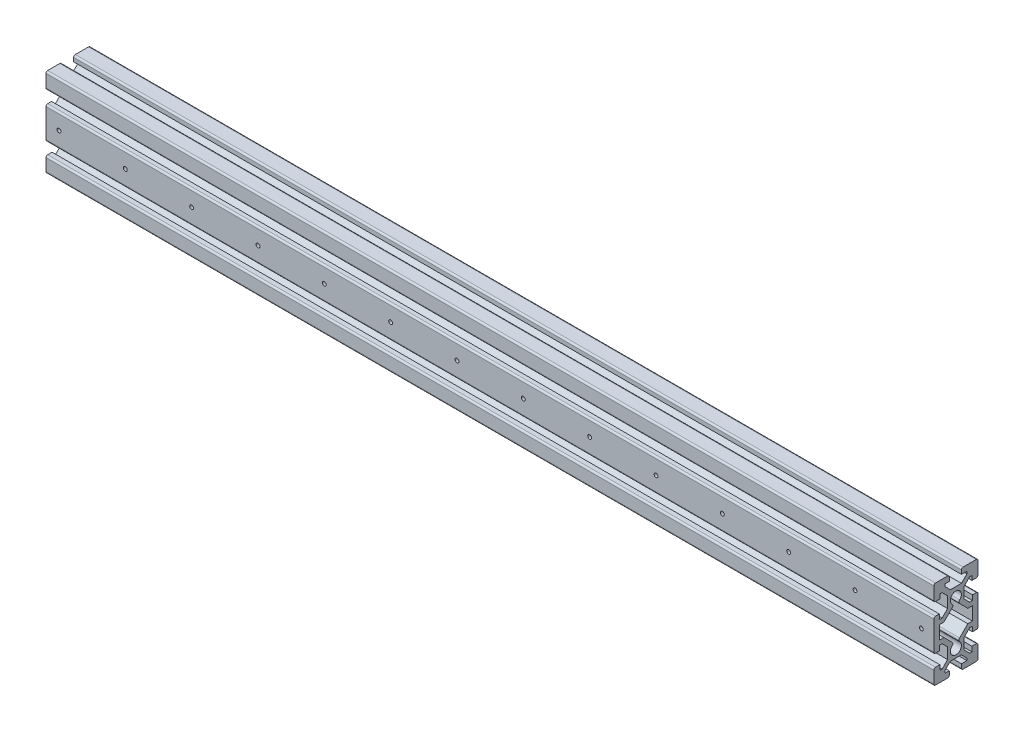
from build123d import *

# Parameters (mm, degrees)
ESTRUSIONE_ESTRUSIONE1_DEPTH = 803
SCHIZZO2_R                   = 1.75
TAGLIO_ESTRUSIONE1_DEPTH     = 10


with BuildPart() as part:
    # Schizzo1 → Estrusione-Estrusione1 (new body)
    with BuildSketch(Plane(origin=(0, 0, 0), x_dir=(0, 0, -1), z_dir=(1, 0, 0))):
        with BuildLine():
            Line((6.5, -39.5), (18.5, -39.5))
            ThreePointArc((18.5, -39.5), (19.560660172, -39.060660172), (20, -38))
            Line((20, -38), (20, -27))
            ThreePointArc((20, -27), (19.560660172, -25.939339828), (18.5, -25.5))
            Line((18.5, -25.5), (14.5, -25.5))
            Line((14.5, -25.5), (14.5, -29.949747468))
            Line((14.5, -29.949747468), (12.449747468, -29.949747468))
            Line((12.449747468, -29.949747468), (7.5, -25))
            Line((7.5, -25), (7.5, -15))
            Line((7.5, -15), (12.449747468, -10.050252532))
            Line((12.449747468, -10.050252532), (15, -10.050252532))
            Line((15, -10.050252532), (15, -14.5))
            Line((15, -14.5), (18.5, -14.5))
            ThreePointArc((18.5, -14.5), (19.560660172, -14.060660172), (20, -13))
            Line((20, -13), (20, 13))
            ThreePointArc((20, 13), (19.560660172, 14.060660172), (18.5, 14.5))
            Line((18.5, 14.5), (15, 14.5))
            Line((15, 14.5), (15, 10.050252532))
            Line((15, 10.050252532), (12.449747468, 10.050252532))
            Line((12.449747468, 10.050252532), (7.5, 15))
            Line((7.5, 15), (7.5, 25))
            Line((7.5, 25), (12.449747468, 29.949747468))
            Line((12.449747468, 29.949747468), (14.5, 29.949747468))
            Line((14.5, 29.949747468), (14.5, 26))
            Line((14.5, 26), (18.5, 26))
            ThreePointArc((18.5, 26), (19.560660172, 26.439339828), (20, 27.5))
            Line((20, 27.5), (20, 39))
            ThreePointArc((20, 39), (19.560660172, 40.060660172), (18.5, 40.5))
            Line((18.5, 40.5), (6.5, 40.5))
            ThreePointArc((6.5, 40.5), (5.439339828, 40.060660172), (5, 39))
            Line((5, 39), (5, 35.5))
            Line((5, 35.5), (9.949747468, 35.5))
            Line((9.949747468, 35.5), (9.949747468, 33.449747468))
            Line((9.949747468, 33.449747468), (5, 28.5))
            Line((5, 28.5), (-5, 28.5))
            Line((-5, 28.5), (-9.949747468, 33.449747468))
            Line((-9.949747468, 33.449747468), (-9.949747468, 35.5))
            Line((-9.949747468, 35.5), (-6, 35.5))
            Line((-6, 35.5), (-6, 39))
            ThreePointArc((-6, 39), (-6.439339828, 40.060660172), (-7.5, 40.5))
            Line((-7.5, 40.5), (-18.5, 40.5))
            ThreePointArc((-18.5, 40.5), (-19.560660172, 40.060660172), (-20, 39))
            Line((-20, 39), (-20, 27.5))
            ThreePointArc((-20, 27.5), (-19.560660172, 26.439339828), (-18.5, 26))
            Line((-18.5, 26), (-14.5, 26))
            Line((-14.5, 26), (-14.5, 29.949747468))
            Line((-14.5, 29.949747468), (-12.449747468, 29.949747468))
            Line((-12.449747468, 29.949747468), (-7.5, 25))
            Line((-7.5, 25), (-7.5, 15))
            Line((-7.5, 15), (-12.449747468, 10.050252532))
            Line((-12.449747468, 10.050252532), (-15, 10.050252532))
            Line((-15, 10.050252532), (-15, 14.5))
            Line((-15, 14.5), (-18.5, 14.5))
            ThreePointArc((-18.5, 14.5), (-19.560660172, 14.060660172), (-20, 13))
            Line((-20, 13), (-20, -13))
            ThreePointArc((-20, -13), (-19.560660172, -14.060660172), (-18.5, -14.5))
            Line((-18.5, -14.5), (-15, -14.5))
            Line((-15, -14.5), (-15, -10.050252532))
            Line((-15, -10.050252532), (-12.449747468, -10.050252532))
            Line((-12.449747468, -10.050252532), (-7.5, -15))
            Line((-7.5, -15), (-7.5, -25))
            Line((-7.5, -25), (-12.449747468, -29.949747468))
            Line((-12.449747468, -29.949747468), (-14.5, -29.949747468))
            Line((-14.5, -29.949747468), (-14.5, -25.5))
            Line((-14.5, -25.5), (-18.5, -25.5))
            ThreePointArc((-18.5, -25.5), (-19.560660172, -25.939339828), (-20, -27))
            Line((-20, -27), (-20, -38))
            ThreePointArc((-20, -38), (-19.560660172, -39.060660172), (-18.5, -39.5))
            Line((-18.5, -39.5), (-7.5, -39.5))
            ThreePointArc((-7.5, -39.5), (-6.439339828, -39.060660172), (-6, -38))
            Line((-6, -38), (-6, -34.5))
            Line((-6, -34.5), (-9.949747468, -34.5))
            Line((-9.949747468, -34.5), (-9.949747468, -32.449747468))
            Line((-9.949747468, -32.449747468), (-5, -27.5))
            Line((-5, -27.5), (5, -27.5))
            Line((5, -27.5), (9.949747468, -32.449747468))
            Line((9.949747468, -32.449747468), (9.949747468, -34.5))
            Line((9.949747468, -34.5), (5, -34.5))
            Line((5, -34.5), (5, -38))
            ThreePointArc((5, -38), (5.439339828, -39.060660172), (6.5, -39.5))
        make_face()
        with BuildLine():
            Line((-15, -6.050252532), (-15, 6.050252532))
            Line((-15, 6.050252532), (-10.792893219, 6.050252532))
            Line((-10.792893219, 6.050252532), (-3.368595607, 13.474550144))
            ThreePointArc((-3.368595607, 13.474550144), (-2.783084428, 14.921944422), (-3.416292264, 16.349116933))
            ThreePointArc((-3.416292264, 16.349116933), (0, 25), (3.416292264, 16.349116933))
            ThreePointArc((3.416292264, 16.349116933), (2.783084428, 14.921944422), (3.368595607, 13.474550144))
            Line((3.368595607, 13.474550144), (10.792893219, 6.050252532))
            Line((10.792893219, 6.050252532), (15, 6.050252532))
            Line((15, 6.050252532), (15, -6.050252532))
            Line((15, -6.050252532), (10.792893219, -6.050252532))
            Line((10.792893219, -6.050252532), (3.368595607, -13.474550144))
            ThreePointArc((3.368595607, -13.474550144), (2.783084428, -14.921944422), (3.416292264, -16.349116933))
            ThreePointArc((3.416292264, -16.349116933), (0, -25), (-3.416292264, -16.349116933))
            ThreePointArc((-3.416292264, -16.349116933), (-2.783084428, -14.921944422), (-3.368595607, -13.474550144))
            Line((-3.368595607, -13.474550144), (-10.792893219, -6.050252532))
            Line((-10.792893219, -6.050252532), (-15, -6.050252532))
        make_face(mode=Mode.SUBTRACT)
    extrude(amount=ESTRUSIONE_ESTRUSIONE1_DEPTH)

    # Schizzo2 → Taglio-Estrusione1 (cut)
    with BuildSketch(Plane.XY.offset(20)):
        with Locations((791.75, 0)):
            Circle(SCHIZZO2_R)
        with Locations((731.75, 0)):
            Circle(SCHIZZO2_R)
        with Locations((671.75, 0)):
            Circle(SCHIZZO2_R)
        with Locations((611.75, 0)):
            Circle(SCHIZZO2_R)
        with Locations((551.75, 0)):
            Circle(SCHIZZO2_R)
        with Locations((491.75, 0)):
            Circle(SCHIZZO2_R)
        with Locations((431.75, 0)):
            Circle(SCHIZZO2_R)
        with Locations((371.75, 0)):
            Circle(SCHIZZO2_R)
        with Locations((311.75, 0)):
            Circle(SCHIZZO2_R)
        with Locations((251.75, 0)):
            Circle(SCHIZZO2_R)
        with Locations((191.75, 0)):
            Circle(SCHIZZO2_R)
        with Locations((131.75, 0)):
            Circle(SCHIZZO2_R)
        with Locations((71.75, 0)):
            Circle(SCHIZZO2_R)
        with Locations((11.75, 0)):
            Circle(SCHIZZO2_R)
    extrude(amount=-TAGLIO_ESTRUSIONE1_DEPTH, mode=Mode.SUBTRACT)


solid = part.part
